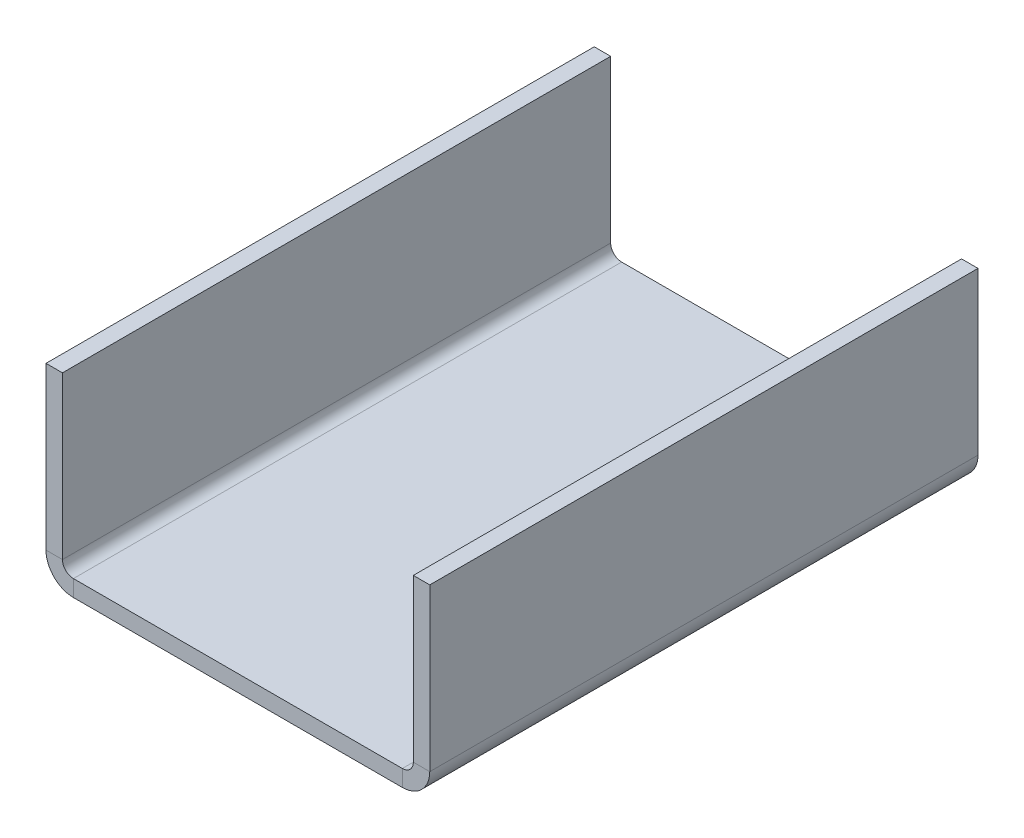
from build123d import *

# Parameters (mm, degrees)
SKETCH1_W              = 130
SKETCH1_H              = 100
BASE_FLANGE1_DEPTH     = 3
SKETCHED_START         = -50
SKETCHED_BEND1_DEPTH   = 100
SKETCHED_BEND1_2_DEPTH = 100


# Read off the part's stored shape, not the designer's step: Sketched Bend1
# Sheet-metal steps are written as plain solids
with BuildPart() as part:
    # Sketch1 → Base-Flange1 (new body)
    with BuildSketch(Plane(origin=(0, 0, 0), x_dir=(1, 0, 0), z_dir=(0, 1, 0))):
        Rectangle(SKETCH1_W, SKETCH1_H)
    extrude(amount=-BASE_FLANGE1_DEPTH)

    # Sketched Bend1 outline → Sketched Bend1 (cut)
    with BuildSketch(Plane.XY.offset(SKETCHED_START)):
        with BuildLine():
            Line((-65, -3), (-30, -3))
            ThreePointArc((-30, -3), (-32.738612788, -2.183300133), (-34.582575695, 0))
            Line((-34.582575695, 0), (-65, 0))
            Line((-65, 0), (-65, -3))
        make_face()
        with BuildLine():
            ThreePointArc((34.582575695, 0), (32.738612788, -2.183300133), (30, -3))
            Line((30, -3), (65, -3))
            Line((65, -3), (65, 0))
            Line((65, 0), (34.582575695, 0))
        make_face()
    extrude(amount=SKETCHED_BEND1_DEPTH, mode=Mode.SUBTRACT)

    # Sketched Bend1 2 outline → Sketched Bend1 2 (add)
    with BuildSketch(Plane.XY.offset(SKETCHED_START)):
        with BuildLine():
            ThreePointArc((-35, 2), (-34.894531565, 0.978451782), (-34.582575695, 0))
            Line((-34.582575695, 0), (-30, 0))
            ThreePointArc((-30, 0), (-31.414213562, 0.585786438), (-32, 2))
            Line((-32, 2), (-32, 31.502212856))
            Line((-32, 31.502212856), (-35, 31.502212856))
            Line((-35, 31.502212856), (-35, 2))
        make_face()
        with BuildLine():
            Line((30, 0), (34.582575695, 0))
            ThreePointArc((34.582575695, 0), (34.894531565, 0.978451782), (35, 2))
            Line((35, 2), (35, 31.502212856))
            Line((35, 31.502212856), (32, 31.502212856))
            Line((32, 31.502212856), (32, 2))
            ThreePointArc((32, 2), (31.414213562, 0.585786438), (30, 0))
        make_face()
    extrude(amount=SKETCHED_BEND1_2_DEPTH)


solid = part.part
